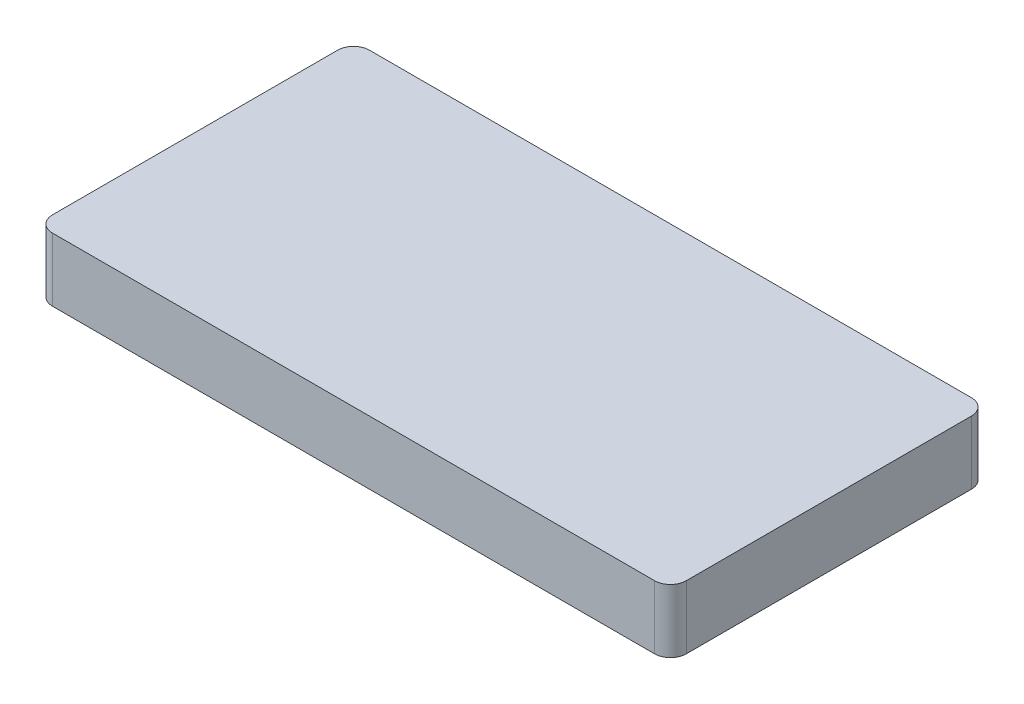
from build123d import *

# Parameters (mm, degrees)
SKETCH1_W           = 25.4
SKETCH1_H           = 12.7
BOSS_EXTRUDE1_DEPTH = 2.54
FILLET1_R           = 0.635
SHELL1_START        = 0.635
SHELL1_OUTLINE_W    = 1.905
SHELL1_OUTLINE_H    = 11.43
SHELL1_DEPTH        = 24.13
SKETCH2_R           = 2.54
BOSS_EXTRUDE2_DEPTH = 1.905


# Read off the part's stored shape, not the designer's step: Shell1
with BuildPart() as part:
    # Sketch1 → Boss-Extrude1 (new body)
    with BuildSketch(Plane(origin=(0, 0, 0), x_dir=(1, 0, 0), z_dir=(0, 1, 0))):
        with Locations((12.7, 6.35)):
            Rectangle(SKETCH1_W, SKETCH1_H)
    extrude(amount=BOSS_EXTRUDE1_DEPTH)

    # Fillet1
    fillet1_edges = [part.edges().sort_by_distance(p)[0] for p in [
        (0, 1.27, -12.7),
        (25.4, 1.27, -12.7),
        (25.4, 1.27, 0),
        (0, 1.27, 0),
    ]]
    fillet(fillet1_edges, radius=FILLET1_R)

    # Shell1 outline → Shell1 (cut)
    with BuildSketch(Plane.YZ.offset(SHELL1_START)):
        with Locations((0.9525, -6.35)):
            Rectangle(SHELL1_OUTLINE_W, SHELL1_OUTLINE_H)
    extrude(amount=SHELL1_DEPTH, mode=Mode.SUBTRACT)

    # Sketch2 → Boss-Extrude2 (add)
    with BuildSketch(Plane(origin=(0, 1.905, 0), x_dir=(-1, 0, 0), z_dir=(0, -1, 0))):
        with Locations(Location((-12.7, 6.35, 0), (0, 0, 270))):
            Circle(SKETCH2_R)
    extrude(amount=BOSS_EXTRUDE2_DEPTH)


solid = part.part
